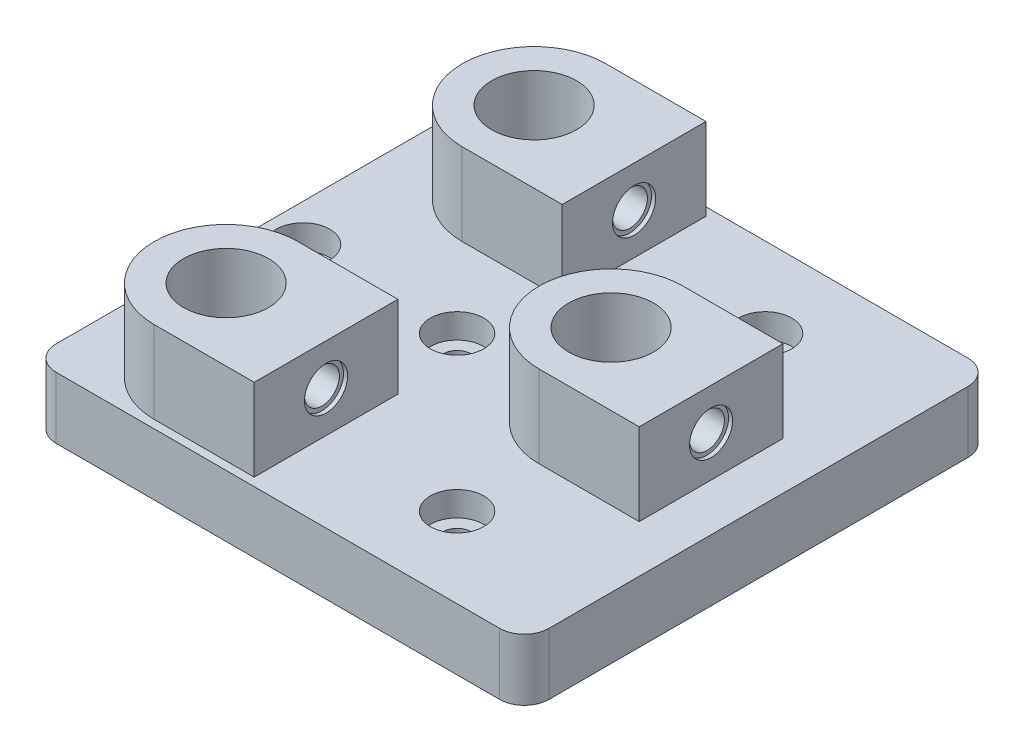
from build123d import *

# Parameters (mm, degrees)
SKETCH1_W                      = 60
SKETCH1_H                      = 57
BOSS_EXTRUDE1_DEPTH            = 7.5
SKETCH3_R                      = 8.75
SKETCH3_R_2                    = 5.175
BOSS_EXTRUDE2_DEPTH            = 10
CUT_EXTRUDE1_START             = -4.5
SKETCH4_R                      = 5.175
CUT_EXTRUDE1_DEPTH             = 4.5
CBORE_FOR_M3_SHCS2_D           = 4.25
CBORE_FOR_M3_SHCS2_DEPTH       = 10
CBORE_FOR_M3_SHCS2_CBORE_D     = 5.25
CBORE_FOR_M3_SHCS2_CBORE_DEPTH = 0.5
SKETCH_PATTERN1_START          = 3
SKETCH_PATTERN1_OUTLINE_R      = 5.175
SKETCH_PATTERN1_DEPTH          = 4.5
SKETCH_PATTERN1_START_2        = 15.125
SKETCH_PATTERN1_2_OUTLINE_R    = 5.175
SKETCH_PATTERN1_2_DEPTH        = 2.375
SKETCH_PATTERN1_START_3        = 7.5
SKETCH_PATTERN1_3_OUTLINE_R    = 5.175
SKETCH_PATTERN1_3_DEPTH        = 2.3749999
SKETCH_PATTERN1_START_4        = 9.8749999
SKETCH_PATTERN1_4_OUTLINE_R    = 5.175
SKETCH_PATTERN1_4_DEPTH        = 5.2500001
SKETCH_PATTERN1_START_5        = -24
SKETCH_PATTERN1_5_OUTLINE_R    = 2.125
SKETCH_PATTERN1_5_DEPTH        = 8.05
SKETCH_PATTERN1_START_6        = 4.718580183
SKETCH_PATTERN1_6_OUTLINE_R    = 2.125
SKETCH_PATTERN1_6_DEPTH        = 7.456419817
SKETCH_PATTERN1_START_7        = -16.45
SKETCH_PATTERN1_7_OUTLINE_R    = 2.625
SKETCH_PATTERN1_7_OUTLINE_R_2  = 2.125
SKETCH_PATTERN1_7_DEPTH        = 0.5
SKETCH_PATTERN1_START_8        = 11.675
SKETCH_PATTERN1_8_OUTLINE_R    = 2.625
SKETCH_PATTERN1_8_OUTLINE_R_2  = 2.125
SKETCH_PATTERN1_8_DEPTH        = 0.5
CBORE_FOR_M3_SHCS1_D           = 3.4
CBORE_FOR_M3_SHCS1_CBORE_D     = 6.5
CBORE_FOR_M3_SHCS1_CBORE_DEPTH = 3
FILLET2_R                      = 3


with BuildPart() as part:
    # Sketch1 → Boss-Extrude1 (new body)
    with BuildSketch(Plane(origin=(0, 0, 0), x_dir=(1, 0, 0), z_dir=(0, 1, 0))):
        with Locations((-12.0625, 0)):
            Rectangle(SKETCH1_W, SKETCH1_H)
    extrude(amount=BOSS_EXTRUDE1_DEPTH)

    # Sketch3 → Boss-Extrude2 (add)
    # profile 1 of 2: a face of its own
    with BuildSketch(Plane(origin=(0, 7.5, 0), x_dir=(1, 0, 0), z_dir=(0, 1, 0))):
        with Locations((-28.125, 18.75)):
            Circle(SKETCH3_R)
        with Locations(Location((-28.125, 18.75, 0), (0, 0, 270))):
            Circle(SKETCH3_R_2, mode=Mode.SUBTRACT)
    # profile 2 of 2: a face of its own
    with BuildSketch(Plane(origin=(0, 7.5, 0), x_dir=(1, 0, 0), z_dir=(0, 1, 0))):
        with BuildLine():
            Line((-15.95, 27.5), (-28.125, 27.5))
            ThreePointArc((-28.125, 27.5), (-21.937815665, 24.937184335), (-19.375, 18.75))
            ThreePointArc((-19.375, 18.75), (-21.937815665, 12.562815665), (-28.125, 10))
            Line((-28.125, 10), (-15.95, 10))
            Line((-15.95, 10), (-15.95, 27.5))
        make_face()
    extrude(amount=BOSS_EXTRUDE2_DEPTH)

    # Sketch4 → Cut-Extrude1 (cut)
    with BuildSketch(Plane(origin=(0, 7.5, 0), x_dir=(1, 0, 0), z_dir=(0, 1, 0)).offset(CUT_EXTRUDE1_START)):
        with Locations(Location((-28.125, 18.75, 0), (0, 0, 270))):
            Circle(SKETCH4_R)
    extrude(amount=CUT_EXTRUDE1_DEPTH, mode=Mode.SUBTRACT)

    # CBORE for M3 SHCS2
    with Locations(Plane(origin=(-15.95, 0, 0), x_dir=(0, 0, -1), z_dir=(1, 0, 0))):
        with Locations((18.75, 12.5)):
            CounterBoreHole(CBORE_FOR_M3_SHCS2_D / 2, CBORE_FOR_M3_SHCS2_CBORE_D / 2, CBORE_FOR_M3_SHCS2_CBORE_DEPTH, depth=CBORE_FOR_M3_SHCS2_DEPTH)

    # Sketch-Pattern1: read off the stored shape, not the designer's step
    # Sketch-Pattern1 outline → Sketch-Pattern1 (cut)
    with BuildSketch(Plane(origin=(0, 0, 0), x_dir=(1, 0, 0), z_dir=(0, 1, 0)).offset(SKETCH_PATTERN1_START)):
        Circle(SKETCH_PATTERN1_OUTLINE_R)
        with Locations((-28.125, -18.75)):
            Circle(SKETCH_PATTERN1_OUTLINE_R)
    extrude(amount=SKETCH_PATTERN1_DEPTH, mode=Mode.SUBTRACT)

    # Sketch-Pattern1 3 outline → Sketch-Pattern1 3 (add)
    # profile 1 of 2: a face of its own
    with BuildSketch(Plane(origin=(0, 0, 0), x_dir=(1, 0, 0), z_dir=(0, 1, 0)).offset(SKETCH_PATTERN1_START_3)):
        with BuildLine():
            Line((-28.125, -27.5), (-15.95, -27.5))
            Line((-15.95, -27.5), (-15.95, -10))
            Line((-15.95, -10), (-28.125, -10))
            ThreePointArc((-28.125, -10), (-36.875, -18.75), (-28.125, -27.5))
        make_face()
        with Locations((-28.125, -18.75)):
            Circle(SKETCH_PATTERN1_3_OUTLINE_R, mode=Mode.SUBTRACT)
    # profile 2 of 2: a face of its own
    with BuildSketch(Plane(origin=(0, 0, 0), x_dir=(1, 0, 0), z_dir=(0, 1, 0)).offset(SKETCH_PATTERN1_START_3)):
        with BuildLine():
            ThreePointArc((0, 8.75), (-8.75, 0), (0, -8.75))
            Line((0, -8.75), (12.175, -8.75))
            Line((12.175, -8.75), (12.175, 8.75))
            Line((12.175, 8.75), (0, 8.75))
        make_face()
        Circle(SKETCH_PATTERN1_3_OUTLINE_R, mode=Mode.SUBTRACT)
    extrude(amount=SKETCH_PATTERN1_3_DEPTH)



with BuildPart() as body_2:
    # Sketch-Pattern1 2 outline → Sketch-Pattern1 2 (new body)
    # profile 1 of 2: a face of its own
    with BuildSketch(Plane(origin=(0, 0, 0), x_dir=(1, 0, 0), z_dir=(0, 1, 0)).offset(SKETCH_PATTERN1_START_2)):
        with BuildLine():
            Line((-28.125, -27.5), (-15.95, -27.5))
            Line((-15.95, -27.5), (-15.95, -10))
            Line((-15.95, -10), (-28.125, -10))
            ThreePointArc((-28.125, -10), (-36.875, -18.75), (-28.125, -27.5))
        make_face()
        with Locations((-28.125, -18.75)):
            Circle(SKETCH_PATTERN1_2_OUTLINE_R, mode=Mode.SUBTRACT)
    # profile 2 of 2: a face of its own
    with BuildSketch(Plane(origin=(0, 0, 0), x_dir=(1, 0, 0), z_dir=(0, 1, 0)).offset(SKETCH_PATTERN1_START_2)):
        with BuildLine():
            ThreePointArc((0, 8.75), (-8.75, 0), (0, -8.75))
            Line((0, -8.75), (12.175, -8.75))
            Line((12.175, -8.75), (12.175, 8.75))
            Line((12.175, 8.75), (0, 8.75))
        make_face()
        Circle(SKETCH_PATTERN1_2_OUTLINE_R, mode=Mode.SUBTRACT)
    extrude(amount=SKETCH_PATTERN1_2_DEPTH)


with BuildPart() as part_1:
    add(part.part)

    add(body_2.part)  # Sketch-Pattern1 4 merges body 2
    # Sketch-Pattern1 4 outline → Sketch-Pattern1 4 (add)
    # profile 1 of 2: a face of its own
    with BuildSketch(Plane(origin=(0, 0, 0), x_dir=(1, 0, 0), z_dir=(0, 1, 0)).offset(SKETCH_PATTERN1_START_4)):
        with BuildLine():
            Line((-28.125, -27.5), (-15.95, -27.5))
            Line((-15.95, -27.5), (-15.95, -10))
            Line((-15.95, -10), (-28.125, -10))
            ThreePointArc((-28.125, -10), (-36.875, -18.75), (-28.125, -27.5))
        make_face()
        with Locations((-28.125, -18.75)):
            Circle(SKETCH_PATTERN1_4_OUTLINE_R, mode=Mode.SUBTRACT)
    # profile 2 of 2: a face of its own
    with BuildSketch(Plane(origin=(0, 0, 0), x_dir=(1, 0, 0), z_dir=(0, 1, 0)).offset(SKETCH_PATTERN1_START_4)):
        with BuildLine():
            ThreePointArc((0, 8.75), (-8.75, 0), (0, -8.75))
            Line((0, -8.75), (12.175, -8.75))
            Line((12.175, -8.75), (12.175, 8.75))
            Line((12.175, 8.75), (0, 8.75))
        make_face()
        Circle(SKETCH_PATTERN1_4_OUTLINE_R, mode=Mode.SUBTRACT)
    extrude(amount=SKETCH_PATTERN1_4_DEPTH)

    # Sketch-Pattern1 5 outline → Sketch-Pattern1 5 (cut)
    with BuildSketch(Plane.YZ.offset(SKETCH_PATTERN1_START_5)):
        with Locations((12.5, 18.75)):
            Circle(SKETCH_PATTERN1_5_OUTLINE_R)
    extrude(amount=SKETCH_PATTERN1_5_DEPTH, mode=Mode.SUBTRACT)

    # Sketch-Pattern1 6 outline → Sketch-Pattern1 6 (cut)
    with BuildSketch(Plane.YZ.offset(SKETCH_PATTERN1_START_6)):
        with Locations((12.5, 0)):
            Circle(SKETCH_PATTERN1_6_OUTLINE_R)
    extrude(amount=SKETCH_PATTERN1_6_DEPTH, mode=Mode.SUBTRACT)

    # Sketch-Pattern1 7 outline → Sketch-Pattern1 7 (cut)
    with BuildSketch(Plane.YZ.offset(SKETCH_PATTERN1_START_7)):
        with Locations((12.5, 18.75)):
            Circle(SKETCH_PATTERN1_7_OUTLINE_R)
        with Locations((12.5, 18.75)):
            Circle(SKETCH_PATTERN1_7_OUTLINE_R_2, mode=Mode.SUBTRACT)
    extrude(amount=SKETCH_PATTERN1_7_DEPTH, mode=Mode.SUBTRACT)

    # Sketch-Pattern1 8 outline → Sketch-Pattern1 8 (cut)
    with BuildSketch(Plane.YZ.offset(SKETCH_PATTERN1_START_8)):
        with Locations((12.5, 0)):
            Circle(SKETCH_PATTERN1_8_OUTLINE_R)
        with Locations((12.5, 0)):
            Circle(SKETCH_PATTERN1_8_OUTLINE_R_2, mode=Mode.SUBTRACT)
    extrude(amount=SKETCH_PATTERN1_8_DEPTH, mode=Mode.SUBTRACT)

    # CBORE for M3 SHCS1 (through all)
    with Locations(Plane(origin=(0, 7.5, 0), x_dir=(1, 0, 0), z_dir=(0, 1, 0))):
        with Locations((-37.5, 0), (0, 18.75), (-18.75, 0), (0, -18.75)):
            CounterBoreHole(CBORE_FOR_M3_SHCS1_D / 2, CBORE_FOR_M3_SHCS1_CBORE_D / 2, CBORE_FOR_M3_SHCS1_CBORE_DEPTH)

    # Fillet2
    fillet2_edges = [part_1.edges().sort_by_distance(p)[0] for p in [
        (-42.0625, 3.75, -28.5),
        (17.9375, 3.75, -28.5),
        (17.9375, 3.75, 28.5),
        (-42.0625, 3.75, 28.5),
    ]]
    fillet(fillet2_edges, radius=FILLET2_R)


solid = part_1.part
